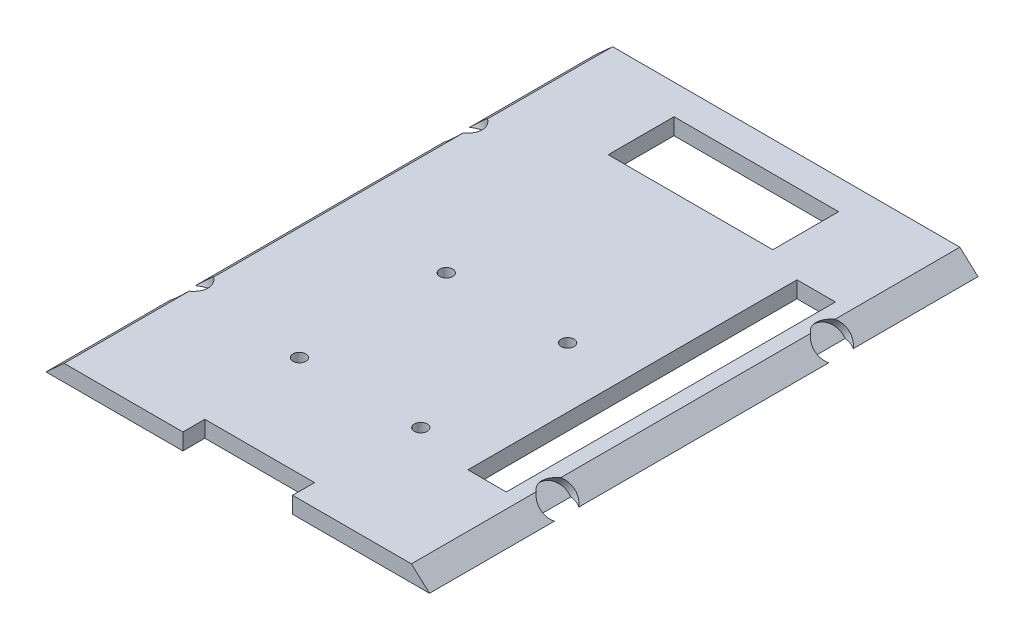
from build123d import *

# Parameters (mm, degrees)
BOSS_EXTRUDE1_DEPTH = 127
SKETCH3_W           = 25.4
SKETCH3_H           = 5.08
CUT_EXTRUDE1_DEPTH  = 135.591199998
SKETCH5_W           = 8.89
SKETCH5_H           = 76.2
CUT_EXTRUDE3_DEPTH  = 135.591199998
SKETCH6_W           = 38.1
SKETCH6_H           = 15.24
CUT_EXTRUDE4_DEPTH  = 135.591199998
SKETCH7_R           = 4.0005
CUT_EXTRUDE5_DEPTH  = 2
SKETCH8_R           = 4.0005
CUT_EXTRUDE6_DEPTH  = 2
SKETCH9_R           = 1.5
CUT_EXTRUDE8_DEPTH  = 135.591199998


with BuildPart() as part:
    # Sketch1 → Boss-Extrude1 (new body)
    with BuildSketch(Plane.XY):
        Polygon((-40.203883769, 5.937788296), (40.203883769, 5.937788296), (44.399042974, 2.127788296), (-44.399042974, 2.127788296), align=None)
    extrude(amount=BOSS_EXTRUDE1_DEPTH)

    # Sketch3 → Cut-Extrude1 (cut, through all)
    with BuildSketch(Plane.XZ.offset(-2.127788296)):
        with Locations((0, 124.46)):
            Rectangle(SKETCH3_W, SKETCH3_H)
    extrude(amount=-CUT_EXTRUDE1_DEPTH, mode=Mode.SUBTRACT)

    # Sketch5 → Cut-Extrude3 (cut, through all)
    with BuildSketch(Plane.XZ.offset(-2.127788296)):
        with Locations((32.334042974, 63.5)):
            Rectangle(SKETCH5_W, SKETCH5_H)
    extrude(amount=-CUT_EXTRUDE3_DEPTH, mode=Mode.SUBTRACT)

    # Sketch6 → Cut-Extrude4 (cut, through all)
    with BuildSketch(Plane.XZ.offset(-2.127788296)):
        with Locations((0, 14.553010533)):
            Rectangle(SKETCH6_W, SKETCH6_H)
    extrude(amount=-CUT_EXTRUDE4_DEPTH, mode=Mode.SUBTRACT)

    # Sketch7 → Cut-Extrude5 (cut)
    with BuildSketch(Plane(origin=(21.127225221, 23.263011377, 0), x_dir=(0.7402720771062569, -0.6723074087475075, 0), z_dir=(0.6723074087475075, 0.7402720771062569, 0))):
        with Locations((28.603318705, -95.263139176)):
            Circle(SKETCH7_R)
        with Locations((28.603318705, -31.736860824)):
            Circle(SKETCH7_R)
    extrude(amount=-CUT_EXTRUDE5_DEPTH, mode=Mode.SUBTRACT)

    # Sketch8 → Cut-Extrude6 (cut)
    with BuildSketch(Plane(origin=(-21.127225221, 23.263011377, 0), x_dir=(0.7402720771062569, 0.6723074087475075, 0), z_dir=(-0.6723074087475075, 0.7402720771062569, 0))):
        with Locations((-28.603318705, -31.775960947)):
            Circle(SKETCH8_R)
        with Locations((-28.603318705, -95.224039053)):
            Circle(SKETCH8_R)
    extrude(amount=-CUT_EXTRUDE6_DEPTH, mode=Mode.SUBTRACT)

    # Sketch9 → Cut-Extrude8 (cut, through all)
    with BuildSketch(Plane(origin=(0, 5.937788296, 0), x_dir=(1, 0, 0), z_dir=(0, 1, 0))):
        with Locations((13.978116231, -98.601597848)):
            Circle(SKETCH9_R)
        with Locations((-14.121883769, -98.601597848)):
            Circle(SKETCH9_R)
        with Locations((-14.121883769, -64.601597848)):
            Circle(SKETCH9_R)
        with Locations((13.978116231, -64.601597848)):
            Circle(SKETCH9_R)
    extrude(amount=-CUT_EXTRUDE8_DEPTH, mode=Mode.SUBTRACT)


solid = part.part
